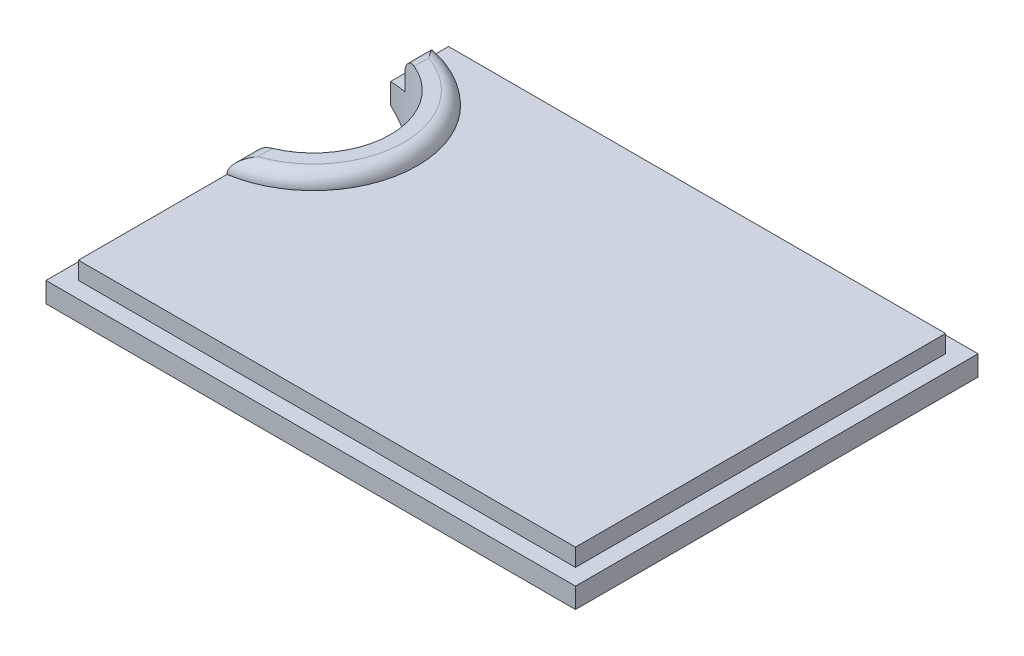
from build123d import *

# Parameters (mm, degrees)
BOSS_EXTRUDE1_DEPTH = 1
BOSS_EXTRUDE2_START = 1
BOSS_EXTRUDE2_DEPTH = 1.6
BOSS_EXTRUDE3_START = 2.6
BOSS_EXTRUDE3_DEPTH = 1.3
BOSS_EXTRUDE4_START = 3.9
BOSS_EXTRUDE4_DEPTH = 1
FILLET1_R           = 1
CHAMFER1_SIZE       = 1.1


with BuildPart() as part:
    # Sketch1 → Boss-Extrude1 (new body)
    with BuildSketch(Plane(origin=(0, 0, 0), x_dir=(1, 0, 0), z_dir=(0, 1, 0))):
        with BuildLine():
            Line((-18.4, 13.7), (-18.4, 12.505918748))
            ThreePointArc((-18.4, 12.505918748), (-11.9, 4.9), (-18.4, -2.705918748))
            Line((-18.4, -2.705918748), (-18.4, -13.7))
            Line((-18.4, -13.7), (18.4, -13.7))
            Line((18.4, -13.7), (18.4, 13.7))
            Line((18.4, 13.7), (-18.4, 13.7))
        make_face()
        with BuildLine():
            ThreePointArc((-18.4, -2.705918748), (-11.9, 4.9), (-18.4, 12.505918748))
            Line((-18.4, 12.505918748), (-18.4, 10.472252686))
            ThreePointArc((-18.4, 10.472252686), (-13.9, 4.9), (-18.4, -0.672252686))
            Line((-18.4, -0.672252686), (-18.4, -2.705918748))
        make_face()
        with BuildLine():
            Line((19.6, 14.9), (-19.6, 14.9))
            Line((-19.6, 14.9), (-19.6, 12.6))
            ThreePointArc((-19.6, 12.6), (-18.998158808, 12.576443654), (-18.4, 12.505918748))
            Line((-18.4, 12.505918748), (-18.4, 13.7))
            Line((-18.4, 13.7), (18.4, 13.7))
            Line((18.4, 13.7), (18.4, -13.7))
            Line((18.4, -13.7), (-18.4, -13.7))
            Line((-18.4, -13.7), (-18.4, -2.705918748))
            ThreePointArc((-18.4, -2.705918748), (-18.998158808, -2.776443654), (-19.6, -2.8))
            Line((-19.6, -2.8), (-19.6, -14.9))
            Line((-19.6, -14.9), (19.6, -14.9))
            Line((19.6, -14.9), (19.6, 14.9))
        make_face()
        with BuildLine():
            ThreePointArc((-18.4, 12.505918748), (-18.998158808, 12.576443654), (-19.6, 12.6))
            Line((-19.6, 12.6), (-19.6, 10.6))
            ThreePointArc((-19.6, 10.6), (-18.996609708, 10.567973196), (-18.4, 10.472252686))
            Line((-18.4, 10.472252686), (-18.4, 12.505918748))
        make_face()
        with BuildLine():
            ThreePointArc((-18.4, -0.672252686), (-18.996609708, -0.767973196), (-19.6, -0.8))
            Line((-19.6, -0.8), (-19.6, -2.8))
            ThreePointArc((-19.6, -2.8), (-18.998158808, -2.776443654), (-18.4, -2.705918748))
            Line((-18.4, -2.705918748), (-18.4, -0.672252686))
        make_face()
    extrude(amount=BOSS_EXTRUDE1_DEPTH)

    # Sketch1<5> → Boss-Extrude2 (add)
    with BuildSketch(Plane(origin=(0, 0, 0), x_dir=(1, 0, 0), z_dir=(0, 1, 0)).offset(BOSS_EXTRUDE2_START)):
        with BuildLine():
            Line((-18.4, 13.7), (-18.4, 12.505918748))
            ThreePointArc((-18.4, 12.505918748), (-11.9, 4.9), (-18.4, -2.705918748))
            Line((-18.4, -2.705918748), (-18.4, -13.7))
            Line((-18.4, -13.7), (18.4, -13.7))
            Line((18.4, -13.7), (18.4, 13.7))
            Line((18.4, 13.7), (-18.4, 13.7))
        make_face()
        with BuildLine():
            ThreePointArc((-18.4, -2.705918748), (-11.9, 4.9), (-18.4, 12.505918748))
            Line((-18.4, 12.505918748), (-18.4, 10.472252686))
            ThreePointArc((-18.4, 10.472252686), (-13.9, 4.9), (-18.4, -0.672252686))
            Line((-18.4, -0.672252686), (-18.4, -2.705918748))
        make_face()
        with BuildLine():
            ThreePointArc((-18.4, 12.505918748), (-18.998158808, 12.576443654), (-19.6, 12.6))
            Line((-19.6, 12.6), (-19.6, 10.6))
            ThreePointArc((-19.6, 10.6), (-18.996609708, 10.567973196), (-18.4, 10.472252686))
            Line((-18.4, 10.472252686), (-18.4, 12.505918748))
        make_face()
        with BuildLine():
            ThreePointArc((-18.4, -0.672252686), (-18.996609708, -0.767973196), (-19.6, -0.8))
            Line((-19.6, -0.8), (-19.6, -2.8))
            ThreePointArc((-19.6, -2.8), (-18.998158808, -2.776443654), (-18.4, -2.705918748))
            Line((-18.4, -2.705918748), (-18.4, -0.672252686))
        make_face()
        with BuildLine():
            Line((19.6, 14.9), (-19.6, 14.9))
            Line((-19.6, 14.9), (-19.6, 12.6))
            ThreePointArc((-19.6, 12.6), (-18.998158808, 12.576443654), (-18.4, 12.505918748))
            Line((-18.4, 12.505918748), (-18.4, 13.7))
            Line((-18.4, 13.7), (18.4, 13.7))
            Line((18.4, 13.7), (18.4, -13.7))
            Line((18.4, -13.7), (-18.4, -13.7))
            Line((-18.4, -13.7), (-18.4, -2.705918748))
            ThreePointArc((-18.4, -2.705918748), (-18.998158808, -2.776443654), (-19.6, -2.8))
            Line((-19.6, -2.8), (-19.6, -14.9))
            Line((-19.6, -14.9), (19.6, -14.9))
            Line((19.6, -14.9), (19.6, 14.9))
        make_face()
    extrude(amount=BOSS_EXTRUDE2_DEPTH)

    # Sketch1<6> → Boss-Extrude3 (add)
    with BuildSketch(Plane(origin=(0, 0, 0), x_dir=(1, 0, 0), z_dir=(0, 1, 0)).offset(BOSS_EXTRUDE3_START)):
        with BuildLine():
            Line((-18.4, 13.7), (-18.4, 12.505918748))
            ThreePointArc((-18.4, 12.505918748), (-11.9, 4.9), (-18.4, -2.705918748))
            Line((-18.4, -2.705918748), (-18.4, -13.7))
            Line((-18.4, -13.7), (18.4, -13.7))
            Line((18.4, -13.7), (18.4, 13.7))
            Line((18.4, 13.7), (-18.4, 13.7))
        make_face()
        with BuildLine():
            ThreePointArc((-18.4, -2.705918748), (-11.9, 4.9), (-18.4, 12.505918748))
            Line((-18.4, 12.505918748), (-18.4, 10.472252686))
            ThreePointArc((-18.4, 10.472252686), (-13.9, 4.9), (-18.4, -0.672252686))
            Line((-18.4, -0.672252686), (-18.4, -2.705918748))
        make_face()
    extrude(amount=BOSS_EXTRUDE3_DEPTH)

    # Sketch1<8> → Boss-Extrude4 (add)
    with BuildSketch(Plane(origin=(0, 0, 0), x_dir=(1, 0, 0), z_dir=(0, 1, 0)).offset(BOSS_EXTRUDE4_START)):
        with BuildLine():
            ThreePointArc((-18.4, -2.705918748), (-11.9, 4.9), (-18.4, 12.505918748))
            Line((-18.4, 12.505918748), (-18.4, 10.472252686))
            ThreePointArc((-18.4, 10.472252686), (-13.9, 4.9), (-18.4, -0.672252686))
            Line((-18.4, -0.672252686), (-18.4, -2.705918748))
        make_face()
    extrude(amount=BOSS_EXTRUDE4_DEPTH)

    # Fillet1
    fillet1_edges = [part.edges().sort_by_distance(p)[0] for p in [
        (-11.9, 4.9, -4.9),
        (-18.4, 4.9, 1.689085717),
        (-18.4, 4.9, -11.489085717),
    ]]
    fillet(fillet1_edges, radius=FILLET1_R - 0.0001)  # a hair under: the kernel refuses the full size

    # Chamfer1
    chamfer1_edges = [part.edges().sort_by_distance(p)[0] for p in [
        (0, 0, 14.9),
        (-19.6, 0, 7.85),
        (-19.6, 0, -12.75),
        (0, 0, -14.9),
        (19.6, 0, 0),
    ]]
    chamfer(chamfer1_edges, length=CHAMFER1_SIZE)


solid = part.part
